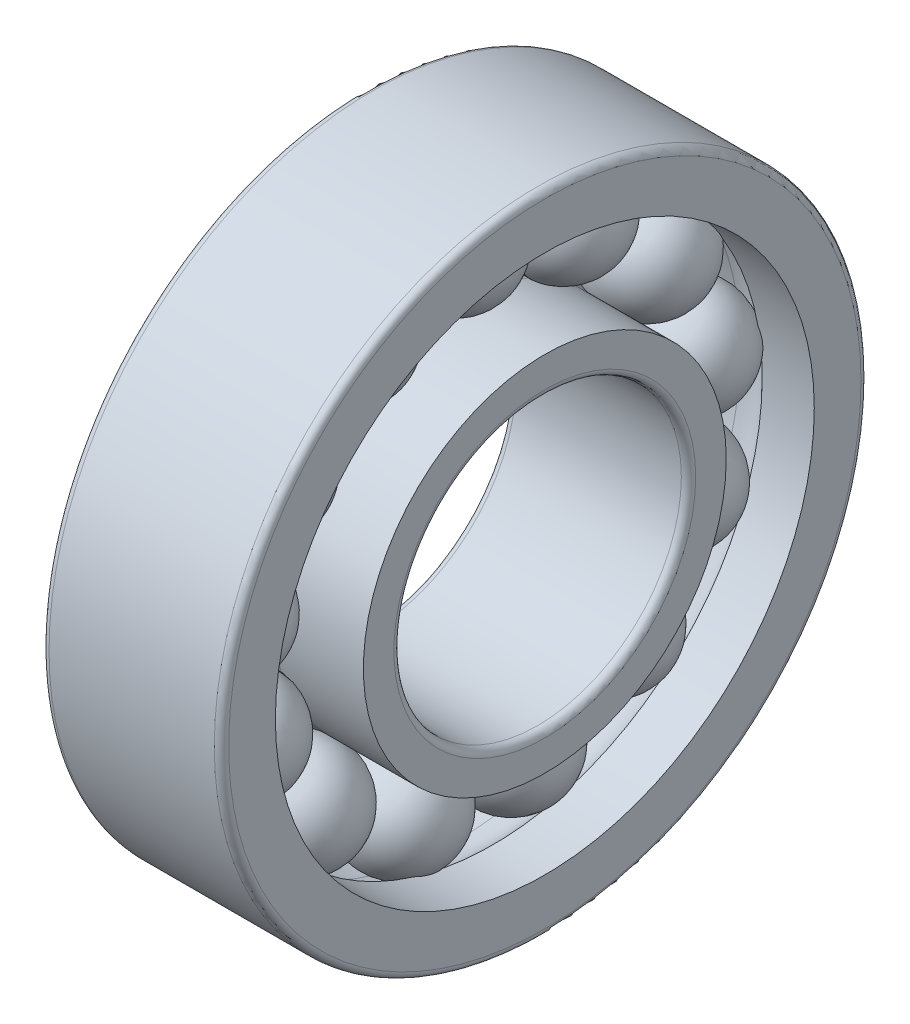
from build123d import *

# Parameters (mm, degrees)
CAGSPISKE_W         = 0.375
CAGSPISKE_H         = 0.25
CAGESPINE_ANGLE     = 0.001
BALLSDETAILED_COUNT = 13
BALLSDETAILED_ANGLE = 332.307692308


with BuildPart() as part:
    # CagSpiSke → CageSpine (revolve)
    with BuildSketch(Plane.XY):
        with Locations((0, 3.25)):
            Rectangle(CAGSPISKE_W, CAGSPISKE_H)
    revolve(axis=Axis((-20.6375, 0, 0), (1, 0, 0)), revolution_arc=CAGESPINE_ANGLE)

    # BalDetSke → BallDetailed (revolve)
    with BuildSketch(Plane.XY):
        with BuildLine():
            Line((-0.75, 3.25), (0.75, 3.25))
            ThreePointArc((0.75, 3.25), (0, 2.5), (-0.75, 3.25))
        make_face()
    balldetailed = revolve(axis=Axis((-1.905, 3.25, 0), (1, 0, 0)))

    # InnRacSke → InnerRace (revolve)
    with BuildSketch(Plane.XY):
        with BuildLine():
            Line((-0.525, 2.75), (-1.25, 2.75))
            Line((-1.25, 2.75), (-1.25, 2.1))
            ThreePointArc((-1.25, 2.1), (-1.220710678, 2.029289322), (-1.15, 2))
            Line((-1.15, 2), (1.15, 2))
            ThreePointArc((1.15, 2), (1.220710678, 2.029289322), (1.25, 2.1))
            Line((1.25, 2.1), (1.25, 2.525))
            Line((1.25, 2.525), (0, 2.525))
            ThreePointArc((0, 2.525), (-0.285591491, 2.583619853), (-0.525, 2.75))
        make_face()
    revolve(axis=Axis((-20.6375, 0, 0), (1, 0, 0)))

    # OutRacSke → OuterRace (revolve)
    with BuildSketch(Plane.XY):
        with BuildLine():
            Line((0, 3.975), (-1.25, 3.975))
            Line((-1.25, 3.975), (-1.25, 4.4))
            ThreePointArc((-1.25, 4.4), (-1.220710678, 4.470710678), (-1.15, 4.5))
            Line((-1.15, 4.5), (1.15, 4.5))
            ThreePointArc((1.15, 4.5), (1.220710678, 4.470710678), (1.25, 4.4))
            Line((1.25, 4.4), (1.25, 3.75))
            Line((1.25, 3.75), (0.525, 3.75))
            ThreePointArc((0.525, 3.75), (0.285591491, 3.916380147), (0, 3.975))
        make_face()
    revolve(axis=Axis((-20.6375, 0, 0), (1, 0, 0)))

    # BallsDetailed: BallDetailed ×13 about axis
    ballsdetailed_axis = Axis((-50, 0, 0), (1, 0, 0))
    for i in range(1, BALLSDETAILED_COUNT):
        add(balldetailed.rotate(ballsdetailed_axis, i * BALLSDETAILED_ANGLE / (BALLSDETAILED_COUNT - 1)))


solid = part.part
